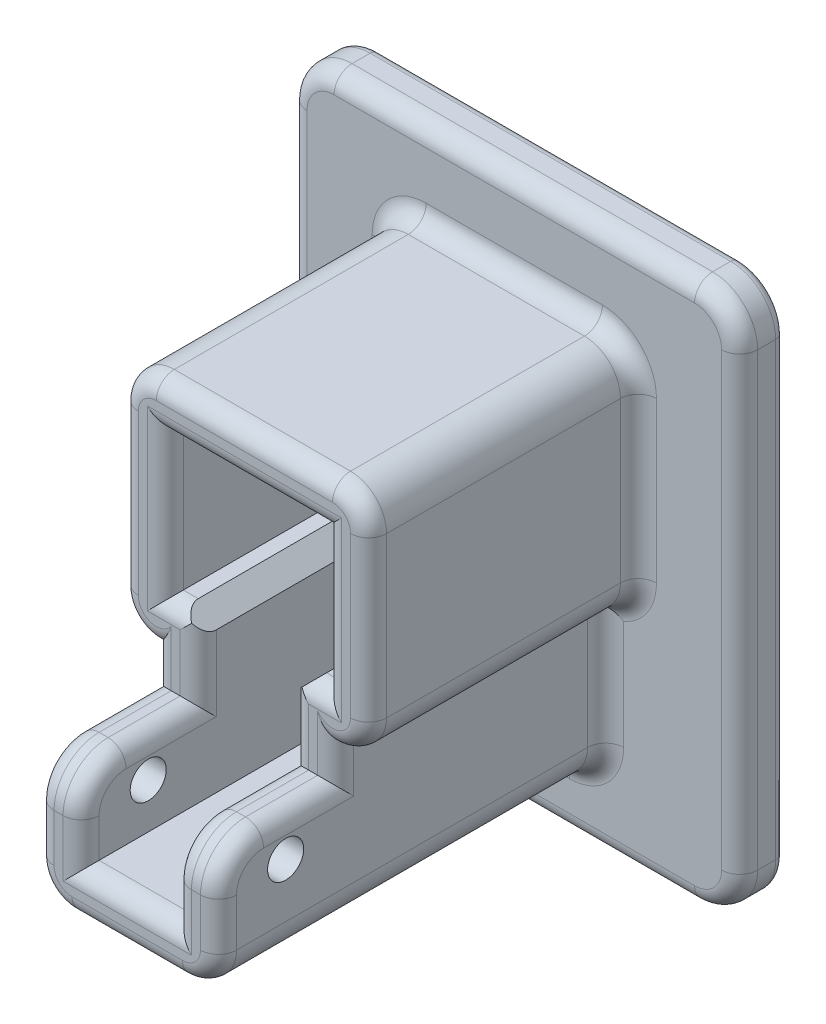
from build123d import *

# Parameters (mm, degrees)
AUFSATZ_LINEAR_AUSTRAGEN1_DEPTH = 29.95
AUFSATZ_LINEAR_AUSTRAGEN2_DEPTH = 13
SKIZZE4_R                       = 2
SCHNITT_LINEAR_AUSTRAGEN1_DEPTH = 20
SKIZZE5_W                       = 50
SKIZZE5_H                       = 60
AUFSATZ_LINEAR_AUSTRAGEN3_DEPTH = 5
FASE1_SIZE                      = 2
VERRUNDUNG1_R                   = 5
VERRUNDUNG4_R                   = 4
VERRUNDUNG7_R                   = 5
VERRUNDUNG5_R                   = 2
VERRUNDUNG8_R                   = 1
VERRUNDUNG9_R                   = 2
VERRUNDUNG12_R                  = 2


with BuildPart() as part:
    # Skizze1 → Aufsatz-Linear austragen1 (new body)
    with BuildSketch(Plane.XY):
        Polygon((-10.125, -22.65), (10.125, -22.65), (10.125, -5), (13.775, -5), (13.775, 20.7), (-13.775, 20.7), (-13.775, -5), (-10.125, -5), align=None)
        Polygon((-5.125, -17.65), (5.125, -17.65), (5.125, 0), (8.775, 0), (8.775, 15.7), (-8.775, 15.7), (-8.775, 0), (-5.125, 0), align=None, mode=Mode.SUBTRACT)
    extrude(amount=AUFSATZ_LINEAR_AUSTRAGEN1_DEPTH)

    # Skizze2 → Aufsatz-Linear austragen2 (add)
    with BuildSketch(Plane.XY.offset(29.95)):
        Polygon((5.125, -17.65), (5.125, -8.35), (10.125, -8.35), (10.125, -22.65), (-10.125, -22.65), (-10.125, -8.35), (-5.125, -8.35), (-5.125, -17.65), align=None)
    extrude(amount=AUFSATZ_LINEAR_AUSTRAGEN2_DEPTH)

    # Skizze4 → Schnitt-Linear austragen1 (cut, symmetric)
    with BuildSketch(Plane(origin=(-5.125, 0, 0), x_dir=(0, 0, -1), z_dir=(1, 0, 0))):
        with Locations(Location((-35.5, -12.65, 0), (0, 0, 180))):
            Circle(SKIZZE4_R)
    extrude(amount=SCHNITT_LINEAR_AUSTRAGEN1_DEPTH, both=True, mode=Mode.SUBTRACT)

    # Skizze5 → Aufsatz-Linear austragen3 (add)
    with BuildSketch(Plane(origin=(0, 0, 0), x_dir=(-1, 0, 0), z_dir=(0, 0, -1))):
        Rectangle(SKIZZE5_W, SKIZZE5_H)
    extrude(amount=AUFSATZ_LINEAR_AUSTRAGEN3_DEPTH)

    # Fase1
    fase1_edges = [part.edges().sort_by_distance(p)[0] for p in [
        (-5.125, 0, 14.975),
        (5.125, 0, 14.975),
    ]]
    chamfer(fase1_edges, length=FASE1_SIZE)

    # Verrundung1
    verrundung1_edges = [part.edges().sort_by_distance(p)[0] for p in [
        (-7.625, -8.35, 42.95),
        (7.625, -8.35, 42.95),
    ]]
    fillet(verrundung1_edges, radius=VERRUNDUNG1_R)

    # Verrundung4
    # the kernel refuses this fillet: 4 mm, written as the material it takes off along each edge
    with BuildSketch(Plane(origin=(13.775, -5, 0), x_dir=(-1, 0, 0), z_dir=(0, 0, 1))) as verrundung4_piece_1:
        with BuildLine():
            CenterArc((4, -3.984658078), VERRUNDUNG4_R, 95.019800132, 84.980199868)
            Line((0, -3.984658078), (0, 0))
            Line((0, 0), (3.65, 0))
        make_face()
    extrude(amount=39.911645195, mode=Mode.SUBTRACT)
    with BuildSketch(Plane(origin=(13.775, 20.7, 0), x_dir=(0, -1, 0), z_dir=(0, 0, 1)), Plane(origin=(-13.775, 20.7, 0), x_dir=(1, 0, 0), z_dir=(0, 0, 1))) as verrundung4_piece_2:
        with BuildLine():
            CenterArc((VERRUNDUNG4_R, -VERRUNDUNG4_R), VERRUNDUNG4_R, 90, 90)
            Line((0, -VERRUNDUNG4_R), (0, 0))
            Line((0, 0), (VERRUNDUNG4_R, 0))
        make_face()
    extrude(amount=39.95, mode=Mode.SUBTRACT)
    with BuildSketch(Plane(origin=(10.125, -22.65, 0), x_dir=(0, 1, 0), z_dir=(0, 0, 1))) as verrundung4_piece_3:
        with BuildLine():
            CenterArc((VERRUNDUNG4_R, VERRUNDUNG4_R), VERRUNDUNG4_R, 180, 90)
            Line((0, VERRUNDUNG4_R), (0, 0))
            Line((0, 0), (VERRUNDUNG4_R, 0))
        make_face()
    extrude(amount=52.95, mode=Mode.SUBTRACT)
    with BuildSketch(Plane(origin=(-10.125, -22.65, 52.95), x_dir=(1, 0, 0), z_dir=(0, 0, -1))) as verrundung4_piece_4:
        with BuildLine():
            CenterArc((VERRUNDUNG4_R, -VERRUNDUNG4_R), VERRUNDUNG4_R, 90, 90)
            Line((0, -VERRUNDUNG4_R), (0, 0))
            Line((0, 0), (VERRUNDUNG4_R, 0))
        make_face()
    extrude(amount=52.95, mode=Mode.SUBTRACT)
    with BuildSketch(Plane(origin=(-13.775, -5, 0), x_dir=(0, 1, 0), z_dir=(0, 0, 1))) as verrundung4_piece_5:
        with BuildLine():
            CenterArc((3.984658078, -4), VERRUNDUNG4_R, 90, 84.980199868)
            Line((0, -3.65), (0, 0))
            Line((0, 0), (3.984658078, 0))
        make_face()
    extrude(amount=39.911645195, mode=Mode.SUBTRACT)

    # Verrundung7
    verrundung7_edges = [part.edges().sort_by_distance(p)[0] for p in [
        (-25, -30, -2.5),
        (-25, 30, -2.5),
        (25, 30, -2.5),
        (25, -30, -2.5),
    ]]
    fillet(verrundung7_edges, radius=VERRUNDUNG7_R)

    # Verrundung5
    verrundung5_edges = [part.edges().sort_by_distance(p)[0] for p in [
        (-10.125, -11.825, 0),
        (0, -22.65, 0),
        (-13.775, 7.842329039, 0),
        (0, 20.7, 0),
        (13.775, 7.842329039, 0),
        (10.125, -11.825, 0),
        (-8.953427125, -21.478427125, 0),
        (-12.724576241, -3.717193139, 0),
        (-12.603427125, 19.528427125, 0),
        (12.724576241, -3.717193139, 0),
        (12.603427125, 19.528427125, 0),
        (8.953427125, -21.478427125, 0),
        (-25, 0, 0),
        (0, -30, 0),
        (25, 0, 0),
        (0, 30, 0),
        (23.535533906, 28.535533906, 0),
        (-23.535533906, 28.535533906, 0),
        (23.535533906, -28.535533906, 0),
        (-23.535533906, -28.535533906, 0),
    ]]
    fillet(verrundung5_edges, radius=VERRUNDUNG5_R)

    # Verrundung8
    verrundung8_edges = [part.edges().sort_by_distance(p)[0] for p in [
        (-25, 0, -5),
        (0, -30, -5),
        (0, 30, -5),
        (25, 0, -5),
        (23.535533906, 28.535533906, -5),
        (-23.535533906, 28.535533906, -5),
        (23.535533906, -28.535533906, -5),
        (-23.535533906, -28.535533906, -5),
    ]]
    fillet(verrundung8_edges, radius=VERRUNDUNG8_R)

    # Verrundung9
    # the kernel refuses this fillet: 2 mm, written as the material it takes off along each edge
    with BuildSketch(Plane(origin=(5.125, -17.65, 42.95), x_dir=(1, 0, 0), z_dir=(0, 1, 0)), Plane(origin=(-5.125, -13.35, 42.95), x_dir=(-1, 0, 0), z_dir=(0, -1, 0))) as verrundung9_piece_1:
        with BuildLine():
            CenterArc((VERRUNDUNG9_R, VERRUNDUNG9_R), VERRUNDUNG9_R, 180, 90)
            Line((0, VERRUNDUNG9_R), (0, 0))
            Line((0, 0), (VERRUNDUNG9_R, 0))
        make_face()
    extrude(amount=4.3, mode=Mode.SUBTRACT)
    with BuildSketch(Plane(origin=(5.125, -13.35, 37.95), x_dir=(0, 1, 0), z_dir=(0, 0, -1))) as verrundung9_piece_2:
        with BuildLine():
            CenterArc((5 - VERRUNDUNG9_R, VERRUNDUNG9_R), VERRUNDUNG9_R, 270, 90)
            Line((5 - VERRUNDUNG9_R, 0), (5, 0))
            Line((5, 0), (5, VERRUNDUNG9_R))
        make_face()
    revolve(axis=Axis((5.125, -13.35, 37.95), (1, 0, 0)), revolution_arc=90, mode=Mode.SUBTRACT)
    with BuildSketch(Plane(origin=(-5.125, -13.35, 37.95), x_dir=(0, 1, 0), z_dir=(0, 0, -1))) as verrundung9_piece_3:
        with BuildLine():
            CenterArc((5 - VERRUNDUNG9_R, -VERRUNDUNG9_R), VERRUNDUNG9_R, 0, 90)
            Line((5 - VERRUNDUNG9_R, 0), (5, 0))
            Line((5, 0), (5, -VERRUNDUNG9_R))
        make_face()
    revolve(axis=Axis((-5.125, -13.35, 37.95), (1, 0, 0)), revolution_arc=90, mode=Mode.SUBTRACT)
    with BuildSketch(Plane(origin=(5.125, -8.35, 29.95), x_dir=(1, 0, 0), z_dir=(0, 0, 1))) as verrundung9_piece_4:
        with BuildLine():
            CenterArc((VERRUNDUNG9_R, -VERRUNDUNG9_R), VERRUNDUNG9_R, 90, 90)
            Line((0, -VERRUNDUNG9_R), (0, 0))
            Line((0, 0), (VERRUNDUNG9_R, 0))
        make_face()
    extrude(amount=8, mode=Mode.SUBTRACT)
    with BuildSketch(Plane(origin=(-5.125, -8.35, 29.95), x_dir=(-1, 0, 0), z_dir=(0, 0, 1))) as verrundung9_piece_5:
        with BuildLine():
            CenterArc((VERRUNDUNG9_R, VERRUNDUNG9_R), VERRUNDUNG9_R, 180, 90)
            Line((0, VERRUNDUNG9_R), (0, 0))
            Line((0, 0), (VERRUNDUNG9_R, 0))
        make_face()
    extrude(amount=8, mode=Mode.SUBTRACT)
    with BuildSketch(Plane(origin=(5.125, -8.35, 29.95), x_dir=(1, 0, 0), z_dir=(0, 1, 0)), Plane(origin=(-5.125, 3, 29.95), x_dir=(-1, 0, 0), z_dir=(0, -1, 0))) as verrundung9_piece_6:
        with BuildLine():
            CenterArc((VERRUNDUNG9_R, VERRUNDUNG9_R), VERRUNDUNG9_R, 180, 90)
            Line((0, VERRUNDUNG9_R), (0, 0))
            Line((0, 0), (VERRUNDUNG9_R, 0))
        make_face()
    extrude(amount=11.35, mode=Mode.SUBTRACT)
    with BuildSketch(Plane(origin=(2.125, 0, 29.95), x_dir=(0, -1, 0), z_dir=(1, 0, 0)), Plane(origin=(-8.775, 0, 29.95), x_dir=(0, -1, 0), z_dir=(1, 0, 0))) as verrundung9_piece_7:
        with BuildLine():
            CenterArc((VERRUNDUNG9_R, VERRUNDUNG9_R), VERRUNDUNG9_R, 180, 90)
            Line((0, VERRUNDUNG9_R), (0, 0))
            Line((0, 0), (VERRUNDUNG9_R, 0))
        make_face()
    extrude(amount=6.65, mode=Mode.SUBTRACT)
    with BuildSketch(Plane(origin=(8.775, 0, 29.95), x_dir=(1, 0, 0), z_dir=(0, 1, 0)), Plane(origin=(-8.775, 15.7, 29.95), x_dir=(-1, 0, 0), z_dir=(0, -1, 0))) as verrundung9_piece_8:
        with BuildLine():
            CenterArc((VERRUNDUNG9_R, VERRUNDUNG9_R), VERRUNDUNG9_R, 180, 90)
            Line((0, VERRUNDUNG9_R), (0, 0))
            Line((0, 0), (VERRUNDUNG9_R, 0))
        make_face()
    extrude(amount=15.7, mode=Mode.SUBTRACT)
    with BuildSketch(Plane(origin=(8.775, 15.7, 29.95), x_dir=(0, 1, 0), z_dir=(-1, 0, 0))) as verrundung9_piece_9:
        with BuildLine():
            CenterArc((VERRUNDUNG9_R, VERRUNDUNG9_R), VERRUNDUNG9_R, 180, 90)
            Line((0, VERRUNDUNG9_R), (0, 0))
            Line((0, 0), (VERRUNDUNG9_R, 0))
        make_face()
    extrude(amount=17.55, mode=Mode.SUBTRACT)
    with BuildSketch(Plane(origin=(-5.125, -17.65, 42.95), x_dir=(0, -1, 0), z_dir=(1, 0, 0))) as verrundung9_piece_10:
        with BuildLine():
            CenterArc((VERRUNDUNG9_R, VERRUNDUNG9_R), VERRUNDUNG9_R, 180, 90)
            Line((0, VERRUNDUNG9_R), (0, 0))
            Line((0, 0), (VERRUNDUNG9_R, 0))
        make_face()
    extrude(amount=10.25, mode=Mode.SUBTRACT)
    with BuildSketch(Plane(origin=(5.125, -22.65, 42.95), x_dir=(1, 0, 0), z_dir=(0, 1, 0))) as verrundung9_piece_11a_section:
        with BuildLine():
            CenterArc((VERRUNDUNG9_R, VERRUNDUNG9_R), VERRUNDUNG9_R, 180, 90)
            Line((0, VERRUNDUNG9_R), (0, 0))
            Line((0, 0), (VERRUNDUNG9_R, 0))
        make_face()
    verrundung9_piece_11a = extrude(amount=9.3, mode=Mode.PRIVATE)
    verrundung9_piece_11a = split(verrundung9_piece_11a, bisect_by=Plane(origin=(5.577790229, -17.65, 42.497209771), z_dir=(0, -1, 0)), keep=Keep.TOP, mode=Mode.PRIVATE)
    with BuildSketch(Plane(origin=(-5.125, -17.65, 42.95), x_dir=(0, -1, 0), z_dir=(1, 0, 0))) as verrundung9_piece_11b_section:
        with BuildLine():
            CenterArc((VERRUNDUNG9_R, VERRUNDUNG9_R), VERRUNDUNG9_R, 180, 90)
            Line((0, VERRUNDUNG9_R), (0, 0))
            Line((0, 0), (VERRUNDUNG9_R, 0))
        make_face()
    verrundung9_piece_11b = extrude(amount=15.25, mode=Mode.PRIVATE)
    verrundung9_piece_11b = split(verrundung9_piece_11b, bisect_by=Plane(origin=(5.125, -18.102790229, 42.497209771), z_dir=(1, 0, 0)), keep=Keep.TOP, mode=Mode.PRIVATE)
    verrundung9_piece_11 = verrundung9_piece_11a & verrundung9_piece_11b
    add(verrundung9_piece_11, mode=Mode.SUBTRACT)
    with BuildSketch(Plane(origin=(-10.125, -17.65, 42.95), x_dir=(0, -1, 0), z_dir=(1, 0, 0))) as verrundung9_piece_12a_section:
        with BuildLine():
            CenterArc((VERRUNDUNG9_R, VERRUNDUNG9_R), VERRUNDUNG9_R, 180, 90)
            Line((0, VERRUNDUNG9_R), (0, 0))
            Line((0, 0), (VERRUNDUNG9_R, 0))
        make_face()
    verrundung9_piece_12a = extrude(amount=15.25, mode=Mode.PRIVATE)
    verrundung9_piece_12a = split(verrundung9_piece_12a, bisect_by=Plane(origin=(-5.125, -18.102790229, 42.497209771), z_dir=(-1, 0, 0)), keep=Keep.TOP, mode=Mode.PRIVATE)
    with BuildSketch(Plane(origin=(-5.125, -13.35, 42.95), x_dir=(-1, 0, 0), z_dir=(0, -1, 0))) as verrundung9_piece_12b_section:
        with BuildLine():
            CenterArc((VERRUNDUNG9_R, VERRUNDUNG9_R), VERRUNDUNG9_R, 180, 90)
            Line((0, VERRUNDUNG9_R), (0, 0))
            Line((0, 0), (VERRUNDUNG9_R, 0))
        make_face()
    verrundung9_piece_12b = extrude(amount=9.3, mode=Mode.PRIVATE)
    verrundung9_piece_12b = split(verrundung9_piece_12b, bisect_by=Plane(origin=(-5.577790229, -17.65, 42.497209771), z_dir=(0, -1, 0)), keep=Keep.TOP, mode=Mode.PRIVATE)
    verrundung9_piece_12 = verrundung9_piece_12a & verrundung9_piece_12b
    add(verrundung9_piece_12, mode=Mode.SUBTRACT)
    with BuildSketch(Plane(origin=(5.125, -13.35, 29.95), x_dir=(1, 0, 0), z_dir=(0, 1, 0))) as verrundung9_piece_13a_section:
        with BuildLine():
            CenterArc((VERRUNDUNG9_R, VERRUNDUNG9_R), VERRUNDUNG9_R, 180, 90)
            Line((0, VERRUNDUNG9_R), (0, 0))
            Line((0, 0), (VERRUNDUNG9_R, 0))
        make_face()
    verrundung9_piece_13a = extrude(amount=16.35, mode=Mode.PRIVATE)
    verrundung9_piece_13a = split(verrundung9_piece_13a, bisect_by=Plane(origin=(5.577790229, -8.35, 29.497209771), z_dir=(0, -1, 0)), keep=Keep.TOP, mode=Mode.PRIVATE)
    with BuildSketch(Plane(origin=(5.125, -8.35, 24.95), x_dir=(1, 0, 0), z_dir=(0, 0, 1))) as verrundung9_piece_13b_section:
        with BuildLine():
            CenterArc((VERRUNDUNG9_R, -VERRUNDUNG9_R), VERRUNDUNG9_R, 90, 90)
            Line((0, -VERRUNDUNG9_R), (0, 0))
            Line((0, 0), (VERRUNDUNG9_R, 0))
        make_face()
    verrundung9_piece_13b = extrude(amount=13, mode=Mode.PRIVATE)
    verrundung9_piece_13b = split(verrundung9_piece_13b, bisect_by=Plane(origin=(5.577790229, -8.802790229, 29.95), z_dir=(0, 0, -1)), keep=Keep.TOP, mode=Mode.PRIVATE)
    verrundung9_piece_13 = verrundung9_piece_13a & verrundung9_piece_13b
    add(verrundung9_piece_13, mode=Mode.SUBTRACT)
    with BuildSketch(Plane(origin=(-5.125, 3, 29.95), x_dir=(-1, 0, 0), z_dir=(0, -1, 0))) as verrundung9_piece_14a_section:
        with BuildLine():
            CenterArc((VERRUNDUNG9_R, VERRUNDUNG9_R), VERRUNDUNG9_R, 180, 90)
            Line((0, VERRUNDUNG9_R), (0, 0))
            Line((0, 0), (VERRUNDUNG9_R, 0))
        make_face()
    verrundung9_piece_14a = extrude(amount=16.35, mode=Mode.PRIVATE)
    verrundung9_piece_14a = split(verrundung9_piece_14a, bisect_by=Plane(origin=(-5.577790229, -8.35, 29.497209771), z_dir=(0, -1, 0)), keep=Keep.TOP, mode=Mode.PRIVATE)
    with BuildSketch(Plane(origin=(-5.125, -8.35, 24.95), x_dir=(-1, 0, 0), z_dir=(0, 0, 1))) as verrundung9_piece_14b_section:
        with BuildLine():
            CenterArc((VERRUNDUNG9_R, VERRUNDUNG9_R), VERRUNDUNG9_R, 180, 90)
            Line((0, VERRUNDUNG9_R), (0, 0))
            Line((0, 0), (VERRUNDUNG9_R, 0))
        make_face()
    verrundung9_piece_14b = extrude(amount=13, mode=Mode.PRIVATE)
    verrundung9_piece_14b = split(verrundung9_piece_14b, bisect_by=Plane(origin=(-5.577790229, -8.802790229, 29.95), z_dir=(0, 0, -1)), keep=Keep.TOP, mode=Mode.PRIVATE)
    verrundung9_piece_14 = verrundung9_piece_14a & verrundung9_piece_14b
    add(verrundung9_piece_14, mode=Mode.SUBTRACT)
    with BuildSketch(Plane(origin=(2.125, 0, 29.95), x_dir=(0, -1, 0), z_dir=(1, 0, 0))) as verrundung9_piece_15a_section:
        with BuildLine():
            CenterArc((VERRUNDUNG9_R, VERRUNDUNG9_R), VERRUNDUNG9_R, 180, 90)
            Line((0, VERRUNDUNG9_R), (0, 0))
            Line((0, 0), (VERRUNDUNG9_R, 0))
        make_face()
    verrundung9_piece_15a = extrude(amount=11.65, mode=Mode.PRIVATE)
    verrundung9_piece_15a = split(verrundung9_piece_15a, bisect_by=Plane(origin=(8.775, -0.452790229, 29.497209771), z_dir=(1, 0, 0)), keep=Keep.TOP, mode=Mode.PRIVATE)
    with BuildSketch(Plane(origin=(8.775, -5, 29.95), x_dir=(1, 0, 0), z_dir=(0, 1, 0))) as verrundung9_piece_15b_section:
        with BuildLine():
            CenterArc((VERRUNDUNG9_R, VERRUNDUNG9_R), VERRUNDUNG9_R, 180, 90)
            Line((0, VERRUNDUNG9_R), (0, 0))
            Line((0, 0), (VERRUNDUNG9_R, 0))
        make_face()
    verrundung9_piece_15b = extrude(amount=20.7, mode=Mode.PRIVATE)
    verrundung9_piece_15b = split(verrundung9_piece_15b, bisect_by=Plane(origin=(9.227790229, 0, 29.497209771), z_dir=(0, -1, 0)), keep=Keep.TOP, mode=Mode.PRIVATE)
    verrundung9_piece_15 = verrundung9_piece_15a & verrundung9_piece_15b
    add(verrundung9_piece_15, mode=Mode.SUBTRACT)
    with BuildSketch(Plane(origin=(8.775, 0, 29.95), x_dir=(1, 0, 0), z_dir=(0, 1, 0))) as verrundung9_piece_16a_section:
        with BuildLine():
            CenterArc((VERRUNDUNG9_R, VERRUNDUNG9_R), VERRUNDUNG9_R, 180, 90)
            Line((0, VERRUNDUNG9_R), (0, 0))
            Line((0, 0), (VERRUNDUNG9_R, 0))
        make_face()
    verrundung9_piece_16a = extrude(amount=20.7, mode=Mode.PRIVATE)
    verrundung9_piece_16a = split(verrundung9_piece_16a, bisect_by=Plane(origin=(9.227790229, 15.7, 29.497209771), z_dir=(0, 1, 0)), keep=Keep.TOP, mode=Mode.PRIVATE)
    with BuildSketch(Plane(origin=(13.775, 15.7, 29.95), x_dir=(0, 1, 0), z_dir=(-1, 0, 0))) as verrundung9_piece_16b_section:
        with BuildLine():
            CenterArc((VERRUNDUNG9_R, VERRUNDUNG9_R), VERRUNDUNG9_R, 180, 90)
            Line((0, VERRUNDUNG9_R), (0, 0))
            Line((0, 0), (VERRUNDUNG9_R, 0))
        make_face()
    verrundung9_piece_16b = extrude(amount=22.55, mode=Mode.PRIVATE)
    verrundung9_piece_16b = split(verrundung9_piece_16b, bisect_by=Plane(origin=(8.775, 16.152790229, 29.497209771), z_dir=(1, 0, 0)), keep=Keep.TOP, mode=Mode.PRIVATE)
    verrundung9_piece_16 = verrundung9_piece_16a & verrundung9_piece_16b
    add(verrundung9_piece_16, mode=Mode.SUBTRACT)
    with BuildSketch(Plane(origin=(8.775, 15.7, 29.95), x_dir=(0, 1, 0), z_dir=(-1, 0, 0))) as verrundung9_piece_17a_section:
        with BuildLine():
            CenterArc((VERRUNDUNG9_R, VERRUNDUNG9_R), VERRUNDUNG9_R, 180, 90)
            Line((0, VERRUNDUNG9_R), (0, 0))
            Line((0, 0), (VERRUNDUNG9_R, 0))
        make_face()
    verrundung9_piece_17a = extrude(amount=22.55, mode=Mode.PRIVATE)
    verrundung9_piece_17a = split(verrundung9_piece_17a, bisect_by=Plane(origin=(-8.775, 16.152790229, 29.497209771), z_dir=(-1, 0, 0)), keep=Keep.TOP, mode=Mode.PRIVATE)
    with BuildSketch(Plane(origin=(-8.775, 20.7, 29.95), x_dir=(-1, 0, 0), z_dir=(0, -1, 0))) as verrundung9_piece_17b_section:
        with BuildLine():
            CenterArc((VERRUNDUNG9_R, VERRUNDUNG9_R), VERRUNDUNG9_R, 180, 90)
            Line((0, VERRUNDUNG9_R), (0, 0))
            Line((0, 0), (VERRUNDUNG9_R, 0))
        make_face()
    verrundung9_piece_17b = extrude(amount=20.7, mode=Mode.PRIVATE)
    verrundung9_piece_17b = split(verrundung9_piece_17b, bisect_by=Plane(origin=(-9.227790229, 15.7, 29.497209771), z_dir=(0, 1, 0)), keep=Keep.TOP, mode=Mode.PRIVATE)
    verrundung9_piece_17 = verrundung9_piece_17a & verrundung9_piece_17b
    add(verrundung9_piece_17, mode=Mode.SUBTRACT)
    with BuildSketch(Plane(origin=(-8.775, 15.7, 29.95), x_dir=(-1, 0, 0), z_dir=(0, -1, 0))) as verrundung9_piece_18a_section:
        with BuildLine():
            CenterArc((VERRUNDUNG9_R, VERRUNDUNG9_R), VERRUNDUNG9_R, 180, 90)
            Line((0, VERRUNDUNG9_R), (0, 0))
            Line((0, 0), (VERRUNDUNG9_R, 0))
        make_face()
    verrundung9_piece_18a = extrude(amount=20.7, mode=Mode.PRIVATE)
    verrundung9_piece_18a = split(verrundung9_piece_18a, bisect_by=Plane(origin=(-9.227790229, 0, 29.497209771), z_dir=(0, -1, 0)), keep=Keep.TOP, mode=Mode.PRIVATE)
    with BuildSketch(Plane(origin=(-13.775, 0, 29.95), x_dir=(0, -1, 0), z_dir=(1, 0, 0))) as verrundung9_piece_18b_section:
        with BuildLine():
            CenterArc((VERRUNDUNG9_R, VERRUNDUNG9_R), VERRUNDUNG9_R, 180, 90)
            Line((0, VERRUNDUNG9_R), (0, 0))
            Line((0, 0), (VERRUNDUNG9_R, 0))
        make_face()
    verrundung9_piece_18b = extrude(amount=11.65, mode=Mode.PRIVATE)
    verrundung9_piece_18b = split(verrundung9_piece_18b, bisect_by=Plane(origin=(-8.775, -0.452790229, 29.497209771), z_dir=(-1, 0, 0)), keep=Keep.TOP, mode=Mode.PRIVATE)
    verrundung9_piece_18 = verrundung9_piece_18a & verrundung9_piece_18b
    add(verrundung9_piece_18, mode=Mode.SUBTRACT)

    # Verrundung12
    verrundung12_edges = [part.edges().sort_by_distance(p)[0] for p in [
        (-12.724576241, -3.717193139, 29.95),
        (-13.775, 7.842329039, 29.95),
        (0, 20.7, 29.95),
        (12.724576241, -3.717193139, 29.95),
        (13.775, 7.842329039, 29.95),
        (10.125, -6.675, 29.95),
        (10.125, -8.35, 33.95),
        (-10.125, -8.35, 33.95),
        (-10.125, -16, 42.95),
        (0, -22.65, 42.95),
        (10.125, -16, 42.95),
        (-10.125, -6.675, 29.95),
    ]]
    fillet(verrundung12_edges, radius=VERRUNDUNG12_R)


solid = part.part
